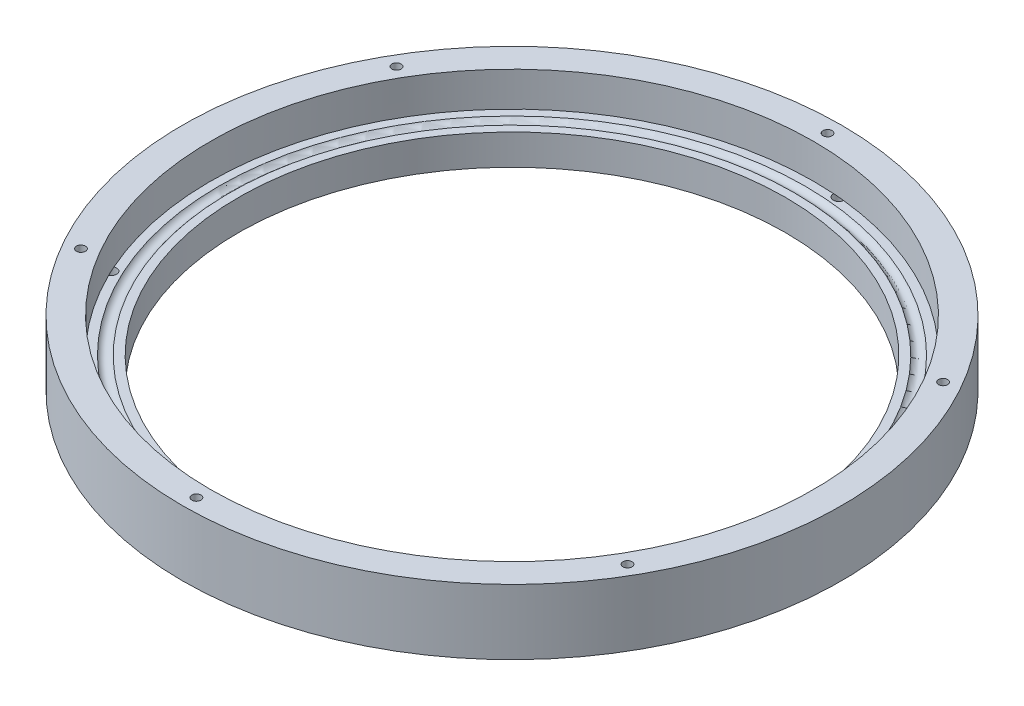
from build123d import *

# Parameters (mm, degrees)
SKETCH1_R                 = 82.2325
SKETCH1_R_2               = 68.2625
SKETCH1_R_3               = 1.1303
SKETCH1_R_4               = 1.3589
BOSS_EXTRUDE1_DEPTH       = 7.62
BOSS_EXTRUDE3_START       = 7.62
SKETCH1_3_R               = 82.2325
SKETCH1_3_R_2             = 1.1303
SKETCH1_3_R_3             = 75.2475
BOSS_EXTRUDE3_DEPTH       = 8.636
CIRPATTERN1_OUTLINE_R     = 1.1303
CIRPATTERN1_DEPTH         = 16.256
SKETCH2_R                 = 1.651
SKETCH1_4_R               = 5.588
SKETCH1_4_R_2             = 1.9939
CUT_EXTRUDE2_DEPTH        = 0.635
SKETCH1_5_R               = 1.9939
CUT_EXTRUDE3_DEPTH        = 6.35
CIRPATTERN3_OUTLINE_R     = 1.3589
CIRPATTERN3_OUTLINE_R_2   = 1.9939
CIRPATTERN3_DEPTH         = 6.35
CIRPATTERN3_2_OUTLINE_R   = 5.588
CIRPATTERN3_2_OUTLINE_R_2 = 1.9939
CIRPATTERN3_2_DEPTH       = 0.635
CIRPATTERN3_START         = 6.35
CIRPATTERN3_3_OUTLINE_R   = 1.3589
CIRPATTERN3_3_DEPTH       = 1.27


# Read off the part's stored shape, not the designer's step: CirPattern1, CirPattern3
with BuildPart() as part:
    # Sketch1 → Boss-Extrude1 (new body)
    with BuildSketch(Plane(origin=(0, 0, 0), x_dir=(1, 0, 0), z_dir=(0, 1, 0))):
        with Locations(Location((0, 0, 0), (0, 0, 90))):
            Circle(SKETCH1_R)
        with Locations(Location((0, 0, 0), (0, 0, 90))):
            Circle(SKETCH1_R_2, mode=Mode.SUBTRACT)
        with Locations(Location((0, -78.74, 0), (0, 0, 90))):
            Circle(SKETCH1_R_3, mode=Mode.SUBTRACT)
        with Locations(Location((61.639143453, -43.160192894, 0), (0, 0, 90))):
            Circle(SKETCH1_R_4, mode=Mode.SUBTRACT)
    extrude(amount=BOSS_EXTRUDE1_DEPTH)

    # Sketch1<3> → Boss-Extrude3 (add)
    with BuildSketch(Plane(origin=(0, 0, 0), x_dir=(1, 0, 0), z_dir=(0, 1, 0)).offset(BOSS_EXTRUDE3_START)):
        with Locations(Location((0, 0, 0), (0, 0, 90))):
            Circle(SKETCH1_3_R)
        with Locations(Location((0, -78.74, 0), (0, 0, 90))):
            Circle(SKETCH1_3_R_2, mode=Mode.SUBTRACT)
        with Locations(Location((0, 0, 0), (0, 0, 326.034722653))):
            Circle(SKETCH1_3_R_3, mode=Mode.SUBTRACT)
    extrude(amount=BOSS_EXTRUDE3_DEPTH)

    # CirPattern1 outline → CirPattern1 (cut)
    with BuildSketch(Plane(origin=(0, 0, 0), x_dir=(1, 0, 0), z_dir=(0, 1, 0))):
        with Locations((-68.190840294, -39.37)):
            Circle(CIRPATTERN1_OUTLINE_R)
        with Locations((-68.190840294, 39.37)):
            Circle(CIRPATTERN1_OUTLINE_R)
        with Locations((0, 78.74)):
            Circle(CIRPATTERN1_OUTLINE_R)
        with Locations((68.190840294, 39.37)):
            Circle(CIRPATTERN1_OUTLINE_R)
        with Locations((68.190840294, -39.37)):
            Circle(CIRPATTERN1_OUTLINE_R)
    extrude(amount=CIRPATTERN1_DEPTH, mode=Mode.SUBTRACT)

    # Sketch2 → Cut-Revolve2 (revolve, cut)
    with BuildSketch(Plane(origin=(0, 0, 0), x_dir=(0, 0, -1), z_dir=(1, 0, 0))):
        with Locations((71.755, 8.509)):
            Circle(SKETCH2_R)
    revolve(axis=Axis((0, 7.62, 0), (0, 1, 0)), mode=Mode.SUBTRACT)

    # Sketch1<4> → Cut-Extrude2 (cut)
    with BuildSketch(Plane(origin=(0, 0, 0), x_dir=(1, 0, 0), z_dir=(0, 1, 0))):
        with Locations(Location((36.98875, -64.066394308, 0), (0, 0, 270))):
            Circle(SKETCH1_4_R)
        with Locations(Location((36.98875, -64.066394308, 0), (0, 0, 270))):
            Circle(SKETCH1_4_R_2, mode=Mode.SUBTRACT)
    extrude(amount=CUT_EXTRUDE2_DEPTH, mode=Mode.SUBTRACT)

    # Sketch1<5> → Cut-Extrude3 (cut)
    with BuildSketch(Plane(origin=(0, 0, 0), x_dir=(1, 0, 0), z_dir=(0, 1, 0))):
        with Locations(Location((36.98875, -64.066394308, 0), (0, 0, 270))):
            Circle(SKETCH1_5_R)
    extrude(amount=CUT_EXTRUDE3_DEPTH, mode=Mode.SUBTRACT)

    # CirPattern3 outline → CirPattern3 (cut)
    with BuildSketch(Plane(origin=(0, 0, 0), x_dir=(1, 0, 0), z_dir=(0, 1, 0))):
        with Locations((-68.197395205, -31.80096765)):
            Circle(CIRPATTERN3_OUTLINE_R)
        with Locations((6.558251752, 74.961160545)):
            Circle(CIRPATTERN3_OUTLINE_R)
        with Locations((36.98875, 64.066394308)):
            Circle(CIRPATTERN3_OUTLINE_R_2)
        with Locations((-73.9775, 0)):
            Circle(CIRPATTERN3_OUTLINE_R_2)
    extrude(amount=CIRPATTERN3_DEPTH, mode=Mode.SUBTRACT)

    # CirPattern3 2 outline → CirPattern3 2 (cut)
    # profile 1 of 2: a face of its own
    with BuildSketch(Plane(origin=(0, 0, 0), x_dir=(1, 0, 0), z_dir=(0, 1, 0))):
        with Locations((-73.9775, 0)):
            Circle(CIRPATTERN3_2_OUTLINE_R)
        with Locations((-73.9775, 0)):
            Circle(CIRPATTERN3_2_OUTLINE_R_2, mode=Mode.SUBTRACT)
    # profile 2 of 2: a face of its own
    with BuildSketch(Plane(origin=(0, 0, 0), x_dir=(1, 0, 0), z_dir=(0, 1, 0))):
        with Locations((36.98875, 64.066394308)):
            Circle(CIRPATTERN3_2_OUTLINE_R)
        with Locations((36.98875, 64.066394308)):
            Circle(CIRPATTERN3_2_OUTLINE_R_2, mode=Mode.SUBTRACT)
    extrude(amount=CIRPATTERN3_2_DEPTH, mode=Mode.SUBTRACT)

    # CirPattern3 3 outline → CirPattern3 3 (cut)
    with BuildSketch(Plane(origin=(0, 0, 0), x_dir=(1, 0, 0), z_dir=(0, 1, 0)).offset(CIRPATTERN3_START)):
        with Locations((-68.197395205, -31.80096765)):
            Circle(CIRPATTERN3_3_OUTLINE_R)
        with Locations((6.558251752, 74.961160545)):
            Circle(CIRPATTERN3_3_OUTLINE_R)
    extrude(amount=CIRPATTERN3_3_DEPTH, mode=Mode.SUBTRACT)


solid = part.part
